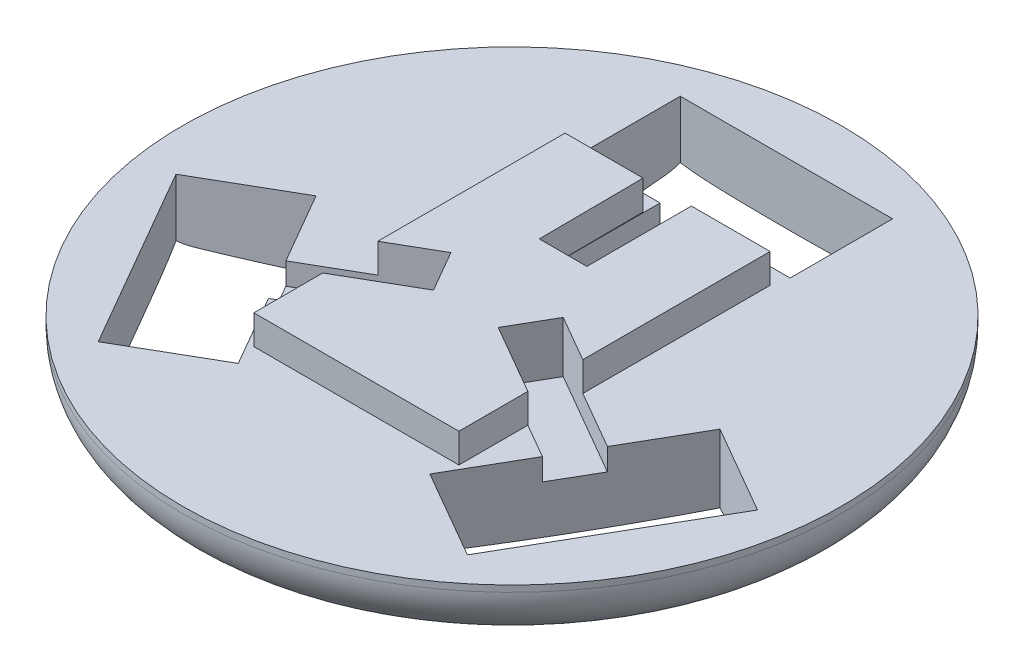
from build123d import *

# Parameters (mm, degrees)
SKETCH2_W           = 58
SKETCH2_H           = 28
CUT_EXTRUDE1_DEPTH  = 40
SKETCH4_W           = 13
SKETCH4_H           = 33
CUT_EXTRUDE2_DEPTH  = 6
BOSS_EXTRUDE1_DEPTH = 8


with BuildPart() as part:
    # Sketch3 → Revolve1 (revolve)
    with BuildSketch(Plane(origin=(0, 0, 0), x_dir=(0, 0, -1), z_dir=(1, 0, 0))):
        with BuildLine():
            Line((90, 18.269120459), (90, 20))
            Line((90, 20), (0, 20))
            Line((0, 20), (0, 0))
            ThreePointArc((0, 0), (38.38346592, 0.40109052), (76.654763153, 3.360674567))
            ThreePointArc((76.654763153, 3.360674567), (86.176346615, 8.264657637), (90, 18.269120459))
        make_face()
    revolve(axis=Axis((0, 20, 0), (0, -1, 0)))

    # Sketch2 → Cut-Extrude1 (cut)
    with BuildSketch(Plane(origin=(0, 0, 0), x_dir=(1, 0, 0), z_dir=(0, 1, 0))):
        with Locations((0, 60.949465814)):
            Rectangle(SKETCH2_W, SKETCH2_H)
        Polygon((79.408141395, -12.359996197), (50.408141395, -62.589469617), (26.159430089, -48.589469617), (55.159430089, 1.640003803), align=None)
        Polygon((-50.408141395, -62.589469617), (-79.408141395, -12.359996197), (-55.159430089, 1.640003803), (-26.159430089, -48.589469617), align=None)
    extrude(amount=CUT_EXTRUDE1_DEPTH, mode=Mode.SUBTRACT)

    # Sketch4 → Cut-Extrude2 (cut)
    with BuildSketch(Plane(origin=(0, 20, 0), x_dir=(1, 0, 0), z_dir=(0, 1, 0))):
        with Locations((0, 30.449465814)):
            Rectangle(SKETCH4_W, SKETCH4_H)
        Polygon((37.409430089, -29.103898031), (43.909430089, -17.845567782), (15.330591764, -1.345567782), (8.830591764, -12.603898031), align=None)
        Polygon((-43.909430089, -17.845567782), (-37.409430089, -29.103898031), (-8.830591764, -12.603898031), (-15.330591764, -1.345567782), align=None)
    extrude(amount=-CUT_EXTRUDE2_DEPTH, mode=Mode.SUBTRACT)

    # Sketch5 → Boss-Extrude1 (add)
    with BuildSketch(Plane(origin=(0, 20, 0), x_dir=(1, 0, 0), z_dir=(0, 1, 0))):
        Polygon((-28, -23.671361037), (-8.830591764, -12.603898031), (-15.330591764, -1.345567782), (-28, -8.660254038), (-28, 42.5), (-6.711328351, 42.5), (-6.5, 13.949465814), (6.5, 13.949465814), (6.5, 42.5), (28, 42.5), (28, -8.660254038), (15.330591764, -1.345567782), (8.830591764, -12.603898031), (28, -23.671361037), (28, -42.5), (-28, -42.5), align=None)
    extrude(amount=BOSS_EXTRUDE1_DEPTH)


solid = part.part
